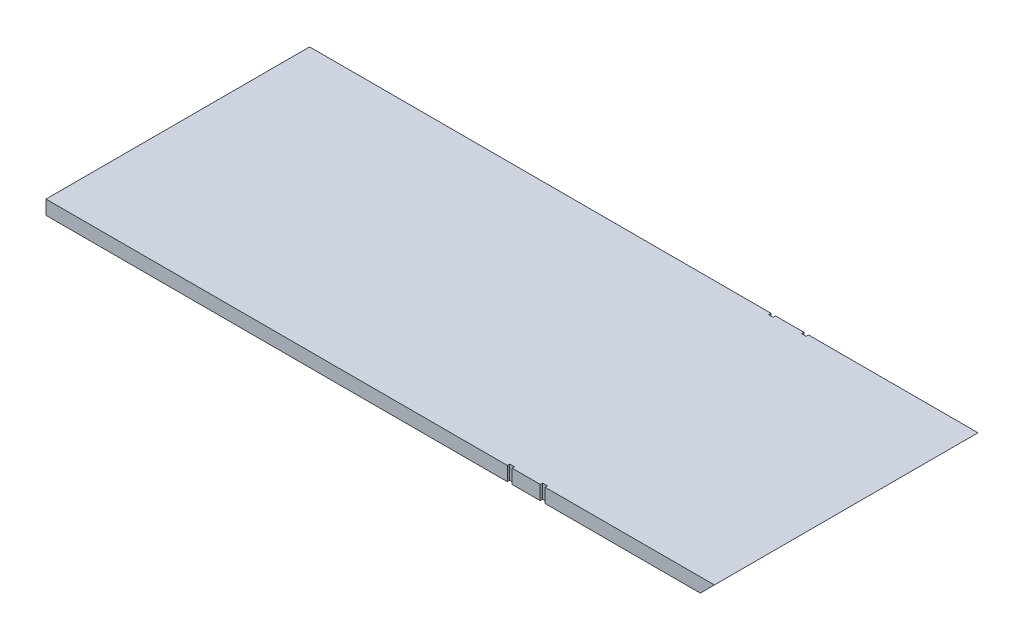
from build123d import *

# Parameters (mm, degrees)
SKETCH1_W           = 901.7
SKETCH1_H           = 355.6
BOSS_EXTRUDE1_DEPTH = 9.525
CHAMFER1_SIZE       = 19.05
SKETCH2_W           = 6.35
SKETCH2_H           = 19.05
CUT_EXTRUDE1_DEPTH  = 3.175
SKETCH3_W           = 6.35
SKETCH3_H           = 19.05
CUT_EXTRUDE2_DEPTH  = 3.175


with BuildPart() as part:
    # Sketch1 → Boss-Extrude1 (new, symmetric)
    with BuildSketch(Plane(origin=(0, 0, 0), x_dir=(1, 0, 0), z_dir=(0, 1, 0))):
        Rectangle(SKETCH1_W, SKETCH1_H)
    extrude(amount=BOSS_EXTRUDE1_DEPTH, both=True)

    # Chamfer1
    chamfer1_edges = [part.edges().sort_by_distance(p)[0] for p in [
        (450.85, -9.525, 0),
    ]]
    chamfer(chamfer1_edges, length=CHAMFER1_SIZE - 0.0001)  # a hair under: the kernel refuses the full size

    # Sketch2 → Cut-Extrude1 (cut)
    with BuildSketch(Plane.XY.offset(177.8)):
        with Locations((174.625, 0)):
            Rectangle(SKETCH2_W, SKETCH2_H)
        with Locations((219.075, 0)):
            Rectangle(SKETCH2_W, SKETCH2_H)
    extrude(amount=-CUT_EXTRUDE1_DEPTH, mode=Mode.SUBTRACT)

    # Sketch3 → Cut-Extrude2 (cut)
    with BuildSketch(Plane(origin=(0, 0, -177.8), x_dir=(-1, 0, 0), z_dir=(0, 0, -1))):
        with Locations((-174.625, 0)):
            Rectangle(SKETCH3_W, SKETCH3_H)
        with Locations((-219.075, 0)):
            Rectangle(SKETCH3_W, SKETCH3_H)
    extrude(amount=-CUT_EXTRUDE2_DEPTH, mode=Mode.SUBTRACT)


solid = part.part
